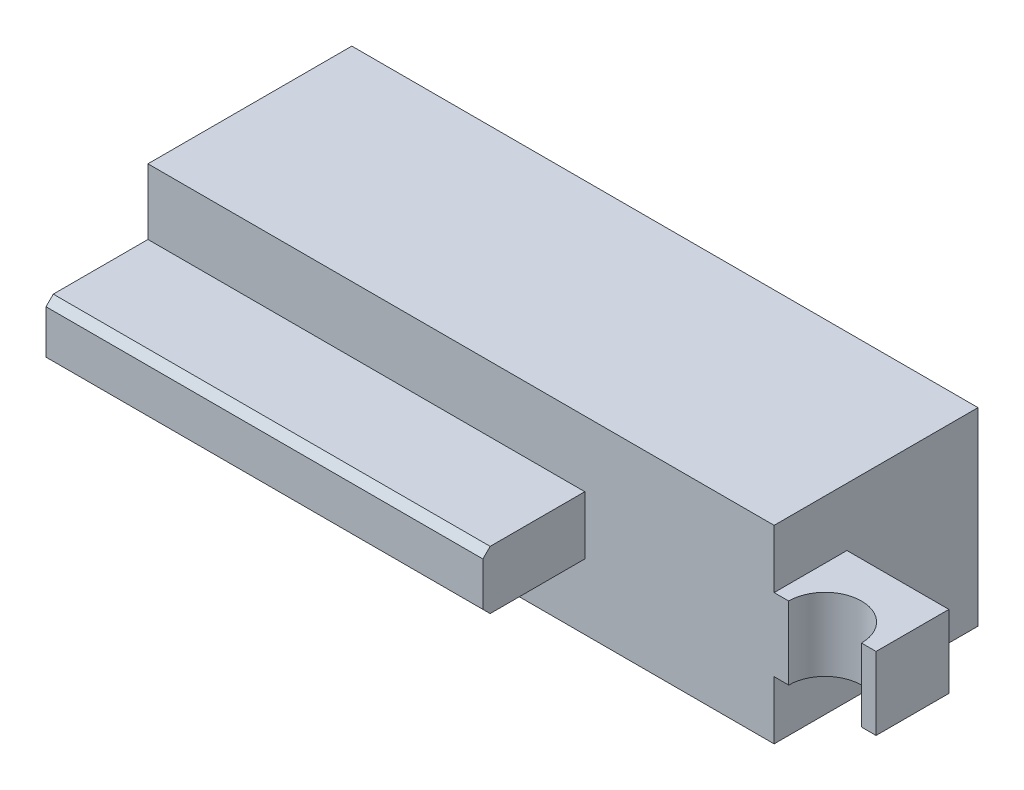
from build123d import *

# Parameters (mm, degrees)
SKETCH_1_W           = 25
SKETCH_1_H           = 17
EXTRUDE_1_DEPTH      = 50
SKETCH_2_W           = 11
SKETCH_2_H           = 6
CUT_EXTRUDE_1_DEPTH  = 50
SKETCH_3_W           = 20
SKETCH_3_H           = 11
CUT_EXTRUDE_2_DEPTH  = 50
SKETCH_4_W           = 7
SKETCH_4_H           = 6
CUT_EXTRUDE_3_DEPTH  = 50
SKETCH_5_W           = 7
SKETCH_5_H           = 9
CUT_EXTRUDE_4_DEPTH  = 50
SKETCH_6_R           = 2.5
CUT_EXTRUDE_5_DEPTH  = 50
SKETCH_7_W           = 14
SKETCH_7_H           = 2
CUT_EXTRUDE_8_DEPTH  = 50
SKETCH_10_W          = 4
SKETCH_10_H          = 5
CUT_EXTRUDE_9_DEPTH  = 50
SKETCH_11_W          = 8
SKETCH_11_H          = 7
CUT_EXTRUDE_10_DEPTH = 30
CUT_EXTRUDE_11_DEPTH = 50
CUT_EXTRUDE_12_DEPTH = 50
SKETCH_14_R          = 1.55
CUT_EXTRUDE_13_DEPTH = 5


with BuildPart() as part:
    # 草图1 → 凸台-拉伸1 (new body)
    with BuildSketch(Plane(origin=(0, 0, 0), x_dir=(0, 0, -1), z_dir=(1, 0, 0))):
        with Locations((12.5, 8.5)):
            Rectangle(SKETCH_1_W, SKETCH_1_H)
    extrude(amount=EXTRUDE_1_DEPTH)

    # 草图2 → 切除-拉伸1 (cut)
    with BuildSketch(Plane.ZY):
        with Locations((-5.5, 14)):
            Rectangle(SKETCH_2_W, SKETCH_2_H)
        with Locations((-5.5, 3)):
            Rectangle(SKETCH_2_W, SKETCH_2_H)
    extrude(amount=-CUT_EXTRUDE_1_DEPTH, mode=Mode.SUBTRACT)

    # 草图3 → 切除-拉伸2 (cut)
    with BuildSketch(Plane(origin=(0, 11, 0), x_dir=(1, 0, 0), z_dir=(0, 1, 0))):
        with Locations((40, 5.5)):
            Rectangle(SKETCH_3_W, SKETCH_3_H)
    extrude(amount=-CUT_EXTRUDE_2_DEPTH, mode=Mode.SUBTRACT)

    # 草图4 → 切除-拉伸3 (cut)
    with BuildSketch(Plane(origin=(0, 0, -25), x_dir=(-1, 0, 0), z_dir=(0, 0, -1))):
        with Locations((-46.5, 14)):
            Rectangle(SKETCH_4_W, SKETCH_4_H)
        with Locations((-46.5, 3)):
            Rectangle(SKETCH_4_W, SKETCH_4_H)
    extrude(amount=-CUT_EXTRUDE_3_DEPTH, mode=Mode.SUBTRACT)

    # 草图5 → 切除-拉伸4 (cut)
    with BuildSketch(Plane(origin=(0, 11, 0), x_dir=(1, 0, 0), z_dir=(0, 1, 0))):
        with Locations((46.5, 20.5)):
            Rectangle(SKETCH_5_W, SKETCH_5_H)
    extrude(amount=-CUT_EXTRUDE_4_DEPTH, mode=Mode.SUBTRACT)

    # 草图6 → 切除-拉伸5 (cut)
    with BuildSketch(Plane(origin=(0, 11, 0), x_dir=(1, 0, 0), z_dir=(0, 1, 0))):
        with Locations((46.5, 11)):
            Circle(SKETCH_6_R)
    extrude(amount=-CUT_EXTRUDE_5_DEPTH, mode=Mode.SUBTRACT)

    # 草图7 → 切除-拉伸8 (cut)
    with BuildSketch(Plane.ZY):
        with Locations((-18, 16)):
            Rectangle(SKETCH_7_W, SKETCH_7_H)
        with Locations((-18, 1)):
            Rectangle(SKETCH_7_W, SKETCH_7_H)
    extrude(amount=-CUT_EXTRUDE_8_DEPTH, mode=Mode.SUBTRACT)

    # 草图10 → 切除-拉伸9 (cut)
    with BuildSketch(Plane.ZY):
        with Locations((-2, 8.5)):
            Rectangle(SKETCH_10_W, SKETCH_10_H)
    extrude(amount=-CUT_EXTRUDE_9_DEPTH, mode=Mode.SUBTRACT)

    # 草图11 → 切除-拉伸10 (cut)
    with BuildSketch(Plane.ZY):
        with Locations((-18, 8.5)):
            Rectangle(SKETCH_11_W, SKETCH_11_H)
    extrude(amount=-CUT_EXTRUDE_10_DEPTH, mode=Mode.SUBTRACT)

    # 草图12 → 切除-拉伸11 (cut)
    with BuildSketch(Plane.ZY):
        Polygon((-4, 11), (-4, 10), (-5, 11), align=None)
        Polygon((-4, 6), (-5, 6), (-4, 7), align=None)
    extrude(amount=-CUT_EXTRUDE_11_DEPTH, mode=Mode.SUBTRACT)

    # 草图13 → 切除-拉伸12 (cut)
    with BuildSketch(Plane.ZY):
        Polygon((-11, 11), (-11, 10.5), (-4.5, 10.5), (-5, 11), align=None)
        Polygon((-4.5, 6.5), (-5, 6), (-11, 6), (-11, 6.5), align=None)
    extrude(amount=-CUT_EXTRUDE_12_DEPTH, mode=Mode.SUBTRACT)

    # 草图14 → 切除-拉伸13 (cut)
    with BuildSketch(Plane(origin=(0, 0, -25), x_dir=(-1, 0, 0), z_dir=(0, 0, -1))):
        with Locations((-3, 8.5)):
            Circle(SKETCH_14_R)
        with Locations((-11, 8.5)):
            Circle(SKETCH_14_R)
    extrude(amount=-CUT_EXTRUDE_13_DEPTH, mode=Mode.SUBTRACT)


solid = part.part
